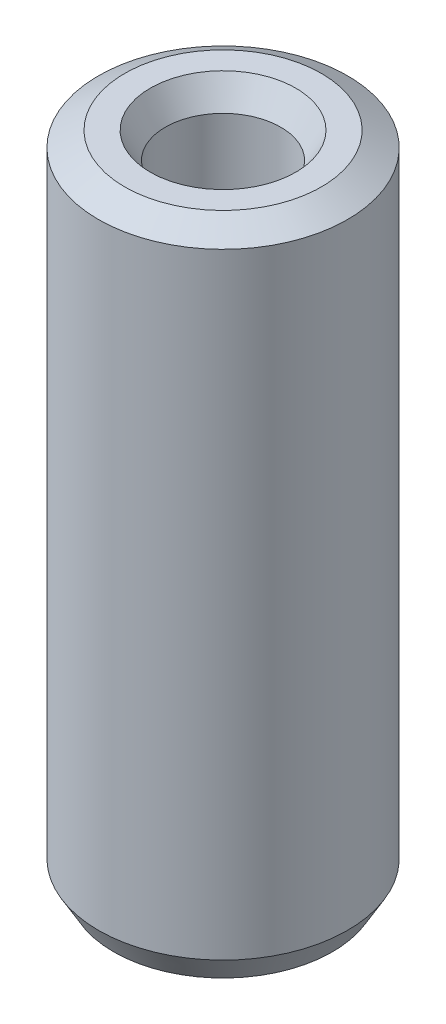
from build123d import *
from OCP.BRepFilletAPI import BRepFilletAPI_MakeChamfer

# Parameters (mm, degrees)
SKETCH1_R           = 17.5
BOSS_EXTRUDE1_DEPTH = 92.295948085
SKETCH2_R           = 8.104678083
CUT_EXTRUDE1_DEPTH  = 96.556486085
CHAMFER1_SIZE       = 2.125780393
CHAMFER1_SIZE2      = 3.681959647


with BuildPart() as part:
    # Sketch1 → Boss-Extrude1 (new body)
    with BuildSketch(Plane(origin=(0, 0, 0), x_dir=(1, 0, 0), z_dir=(0, 1, 0))):
        Circle(SKETCH1_R)
    extrude(amount=BOSS_EXTRUDE1_DEPTH)

    # Sketch2 → Cut-Extrude1 (cut, through all)
    with BuildSketch(Plane(origin=(0, 0, 0), x_dir=(1, 0, 0), z_dir=(0, 1, 0))):
        Circle(SKETCH2_R)
    extrude(amount=CUT_EXTRUDE1_DEPTH, mode=Mode.SUBTRACT)

    # Chamfer1: one chamfer whose edges measure the first distance from different faces: ONE call of the kernel's chamfer builder (chamfer() names one face for all edges)
    chamfer1_edges_1 = [part.edges().sort_by_distance(p)[0] for p in [
        (-8.104678083, 92.295948085, 0),
    ]]
    chamfer1_side_1 = [part.faces().sort_by_distance(p)[0] for p in [
        (-17.005025253, 92.295948085, 0),
    ]]
    chamfer1_edges_2 = [part.edges().sort_by_distance(p)[0] for p in [
        (-8.104678083, 0, 0),
    ]]
    chamfer1_side_2 = [part.faces().sort_by_distance(p)[0] for p in [
        (-8.104678083, 46.147974042, 0),
    ]]
    chamfer1_edges_3 = [part.edges().sort_by_distance(p)[0] for p in [
        (-17.5, 0, 0),
    ]]
    chamfer1_side_3 = [part.faces().sort_by_distance(p)[0] for p in [
        (-17.005025253, 0, 0),
    ]]
    chamfer1_edges_4 = [part.edges().sort_by_distance(p)[0] for p in [
        (-17.5, 92.295948085, 0),
    ]]
    chamfer1_side_4 = [part.faces().sort_by_distance(p)[0] for p in [
        (-17.5, 46.147974042, 0),
    ]]
    chamfer1 = BRepFilletAPI_MakeChamfer(part.part.solid().wrapped)
    for e in chamfer1_edges_1:
        chamfer1.Add(CHAMFER1_SIZE, CHAMFER1_SIZE2, e.wrapped, chamfer1_side_1[0].wrapped)  # the first distance lies on this face
    for e in chamfer1_edges_2:
        chamfer1.Add(CHAMFER1_SIZE, CHAMFER1_SIZE2, e.wrapped, chamfer1_side_2[0].wrapped)  # the first distance lies on this face
    for e in chamfer1_edges_3:
        chamfer1.Add(CHAMFER1_SIZE, CHAMFER1_SIZE2, e.wrapped, chamfer1_side_3[0].wrapped)  # the first distance lies on this face
    for e in chamfer1_edges_4:
        chamfer1.Add(CHAMFER1_SIZE, CHAMFER1_SIZE2, e.wrapped, chamfer1_side_4[0].wrapped)  # the first distance lies on this face
    add(Compound.cast(chamfer1.Shape()), mode=Mode.REPLACE)


solid = part.part
